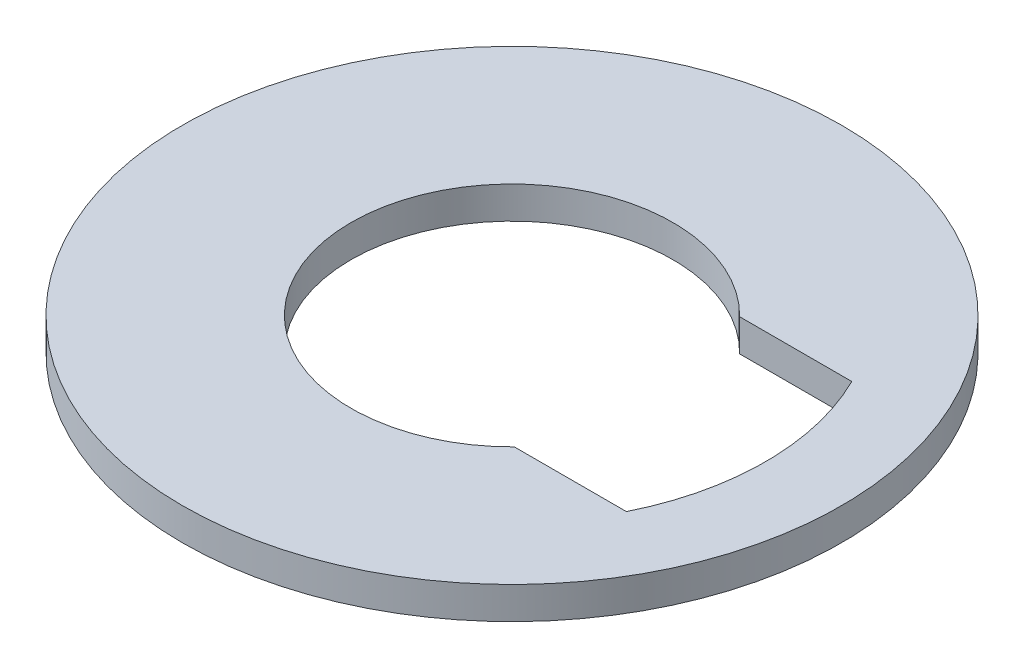
from build123d import *

# Parameters (mm, degrees)
SKETCH4_R           = 32.5
BOSS_EXTRUDE1_DEPTH = 3.175


with BuildPart() as part:
    # Sketch4 → Boss-Extrude1 (new body)
    with BuildSketch(Plane(origin=(0, 24.13, 0), x_dir=(1, 0, 0), z_dir=(0, 1, 0))):
        Circle(SKETCH4_R)
        with BuildLine():
            Line((22.394471276, 11.1125), (11.33701763, 11.1125))
            ThreePointArc((11.33701763, 11.1125), (-15.875, 0), (11.33701763, -11.1125))
            Line((11.33701763, -11.1125), (22.394471276, -11.1125))
            ThreePointArc((22.394471276, -11.1125), (25, 0), (22.394471276, 11.1125))
        make_face(mode=Mode.SUBTRACT)
    extrude(amount=-BOSS_EXTRUDE1_DEPTH)


solid = part.part
